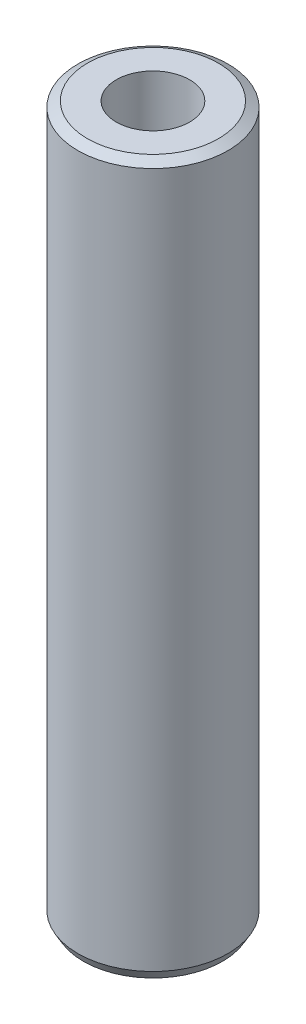
from build123d import *
from OCP.BRepFilletAPI import BRepFilletAPI_MakeChamfer

# Parameters (mm, degrees)
SKETCH1_R           = 47.5
BOSS_EXTRUDE1_DEPTH = 449.503892618
SKETCH2_R           = 23.223694433
CUT_EXTRUDE1_DEPTH  = 455.495598965
CHAMFER1_SIZE       = 3.495404941
CHAMFER1_SIZE2      = 6.054218951


with BuildPart() as part:
    # Sketch1 → Boss-Extrude1 (new body)
    with BuildSketch(Plane(origin=(0, 0, 0), x_dir=(1, 0, 0), z_dir=(0, 1, 0))):
        Circle(SKETCH1_R)
    extrude(amount=BOSS_EXTRUDE1_DEPTH)

    # Sketch2 → Cut-Extrude1 (cut, through all)
    with BuildSketch(Plane(origin=(0, 0, 0), x_dir=(1, 0, 0), z_dir=(0, 1, 0))):
        Circle(SKETCH2_R)
    extrude(amount=CUT_EXTRUDE1_DEPTH, mode=Mode.SUBTRACT)

    # Chamfer1: one chamfer whose edges measure the first distance from different faces: ONE call of the kernel's chamfer builder (chamfer() names one face for all edges)
    chamfer1_edges_1 = [part.edges().sort_by_distance(p)[0] for p in [
        (-47.5, 449.503892618, 0),
    ]]
    chamfer1_side_1 = [part.faces().sort_by_distance(p)[0] for p in [
        (-47.5, 224.751946309, 0),
    ]]
    chamfer1_edges_2 = [part.edges().sort_by_distance(p)[0] for p in [
        (-47.5, 0, 0),
    ]]
    chamfer1_side_2 = [part.faces().sort_by_distance(p)[0] for p in [
        (-46.156497116, 0, 0),
    ]]
    chamfer1 = BRepFilletAPI_MakeChamfer(part.part.solid().wrapped)
    for e in chamfer1_edges_1:
        chamfer1.Add(CHAMFER1_SIZE, CHAMFER1_SIZE2, e.wrapped, chamfer1_side_1[0].wrapped)  # the first distance lies on this face
    for e in chamfer1_edges_2:
        chamfer1.Add(CHAMFER1_SIZE, CHAMFER1_SIZE2, e.wrapped, chamfer1_side_2[0].wrapped)  # the first distance lies on this face
    add(Compound.cast(chamfer1.Shape()), mode=Mode.REPLACE)


solid = part.part
